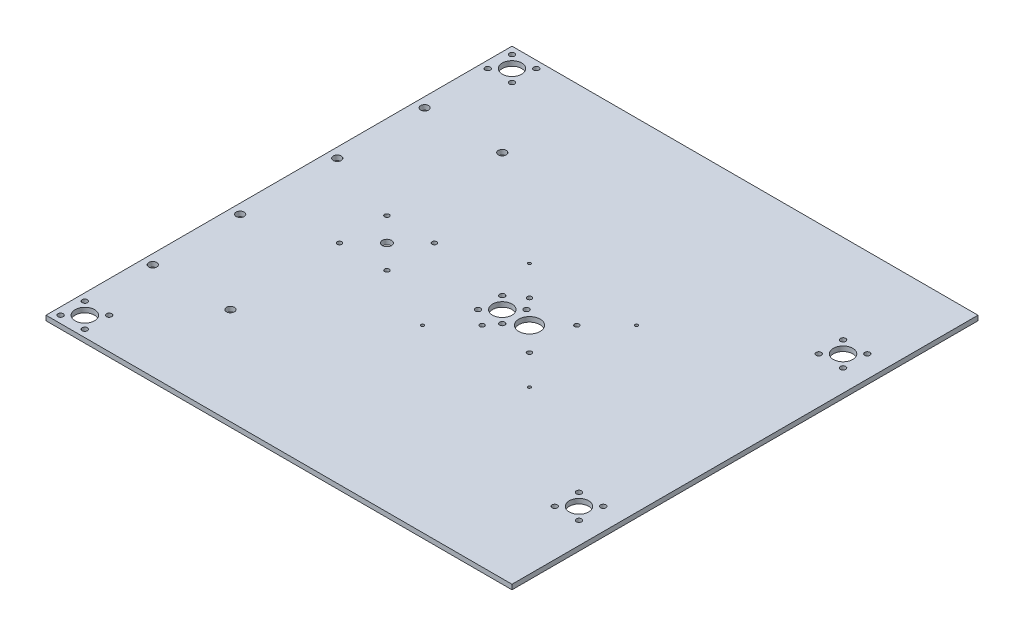
from build123d import *

# Parameters (mm, degrees)
SKETCH1_W               = 304.8
SKETCH1_H               = 304.8
BOSS_EXTRUDE1_DEPTH     = 3.175
SKETCH3_R               = 2.600000007
CUT_EXTRUDE1_DEPTH      = 216.549531721
SKETCH5_R               = 1.5
SKETCH5_R_2             = 2.999999969
CUT_EXTRUDE2_DEPTH      = 216.549531721
SKETCH7_R               = 0.999998
CUT_EXTRUDE3_DEPTH      = 216.549531721
CUT_EXTRUDE5_DEPTH      = 216.549531721
CUT_EXTRUDE5_DEPTH_BACK = 216.549531721
SKETCH9_R               = 1.726999975
SKETCH9_R_2             = 6.35
CUT_EXTRUDE6_DEPTH      = 216.549531721
CUT_EXTRUDE6_DEPTH_BACK = 216.549531721
SKETCH11_R              = 1.5
SKETCH11_R_2            = 6.985


with BuildPart() as part:
    # Sketch1 → Boss-Extrude1 (new body)
    with BuildSketch(Plane(origin=(0, 0, 0), x_dir=(1, 0, 0), z_dir=(0, 1, 0))):
        Rectangle(SKETCH1_W, SKETCH1_H)
    extrude(amount=BOSS_EXTRUDE1_DEPTH)

    # Sketch3 → Cut-Extrude1 (cut, through all)
    with BuildSketch(Plane(origin=(0, 3.175, 0), x_dir=(1, 0, 0), z_dir=(0, 1, 0))):
        with Locations((-146.05, -31.75)):
            Circle(SKETCH3_R)
        with Locations((-95.25, -88.9)):
            Circle(SKETCH3_R)
        with Locations((-146.05, -88.9)):
            Circle(SKETCH3_R)
    cut_extrude1 = extrude(amount=-CUT_EXTRUDE1_DEPTH, mode=Mode.SUBTRACT)

    # Mirror1: Cut-Extrude1 across plane
    add(cut_extrude1.mirror(Plane.XY), mode=Mode.SUBTRACT)

    # Sketch5 → Cut-Extrude2 (cut, through all)
    with BuildSketch(Plane(origin=(0, 3.175, 0), x_dir=(1, 0, 0), z_dir=(0, 1, 0))):
        with Locations((-66.312, 15.5)):
            Circle(SKETCH5_R)
        with Locations((-66.312, -15.5)):
            Circle(SKETCH5_R)
        with Locations((-97.312, 15.5)):
            Circle(SKETCH5_R)
        with Locations((-97.312, -15.5)):
            Circle(SKETCH5_R)
        with Locations((-81.812, 0)):
            Circle(SKETCH5_R_2)
    extrude(amount=-CUT_EXTRUDE2_DEPTH, mode=Mode.SUBTRACT)

    # Sketch7 → Cut-Extrude3 (cut, through all)
    with BuildSketch(Plane(origin=(0, 3.175, 0), x_dir=(1, 0, 0), z_dir=(0, 1, 0))):
        with Locations((46.431794783, -35.001777937)):
            Circle(SKETCH7_R)
        with Locations((-23.571780232, -35.001777937)):
            Circle(SKETCH7_R)
        with Locations((-23.571780232, 35.001797077)):
            Circle(SKETCH7_R)
        with Locations((46.431794783, 35.001797077)):
            Circle(SKETCH7_R)
    extrude(amount=-CUT_EXTRUDE3_DEPTH, mode=Mode.SUBTRACT)

    # Sketch9 → Cut-Extrude5 (cut, two sides: drawn at the far end of the back side and taken through both)
    with BuildSketch(Plane(origin=(0, 3.175, 0), x_dir=(1, 0, 0), z_dir=(0, 1, 0)).offset(-CUT_EXTRUDE5_DEPTH_BACK)):
        with Locations((-131.7625, -147.6375)):
            Circle(SKETCH9_R)
        with Locations((-131.7625, -131.7625)):
            Circle(SKETCH9_R)
        with Locations((-147.6375, -131.7625)):
            Circle(SKETCH9_R)
        with Locations((-147.6375, -147.6375)):
            Circle(SKETCH9_R)
        with Locations((-139.7, -139.7)):
            Circle(SKETCH9_R_2)
        with Locations((138.1125, -94.2975)):
            Circle(SKETCH9_R)
        with Locations((138.1125, -78.4225)):
            Circle(SKETCH9_R)
        with Locations((130.175, -86.36)):
            Circle(SKETCH9_R_2)
        with Locations((122.2375, -78.4225)):
            Circle(SKETCH9_R)
        with Locations((122.2375, -94.2975)):
            Circle(SKETCH9_R)
        with Locations((1.5875, 7.9375)):
            Circle(SKETCH9_R)
        with Locations((1.5875, -7.9375)):
            Circle(SKETCH9_R)
        with Locations((-6.35, 0)):
            Circle(SKETCH9_R_2)
        with Locations((-14.2875, -7.9375)):
            Circle(SKETCH9_R)
        with Locations((-14.2875, 7.9375)):
            Circle(SKETCH9_R)
        with Locations((122.2375, 94.2975)):
            Circle(SKETCH9_R)
        with Locations((122.2375, 78.4225)):
            Circle(SKETCH9_R)
        with Locations((138.1125, 94.2975)):
            Circle(SKETCH9_R)
        with Locations((130.175, 86.36)):
            Circle(SKETCH9_R_2)
        with Locations((138.1125, 78.4225)):
            Circle(SKETCH9_R)
        with Locations((-131.7625, 131.7625)):
            Circle(SKETCH9_R)
        with Locations((-131.7625, 147.6375)):
            Circle(SKETCH9_R)
        with Locations((-147.6375, 147.6375)):
            Circle(SKETCH9_R)
        with Locations((-147.6375, 131.7625)):
            Circle(SKETCH9_R)
        with Locations((-139.7, 139.7)):
            Circle(SKETCH9_R_2)
    extrude(amount=CUT_EXTRUDE5_DEPTH + CUT_EXTRUDE5_DEPTH_BACK, mode=Mode.SUBTRACT)

    # Sketch11 → Cut-Extrude6 (cut, two sides: drawn at the far end of the back side and taken through both)
    with BuildSketch(Plane(origin=(0, 3.175, 0), x_dir=(1, 0, 0), z_dir=(0, 1, 0)).offset(-CUT_EXTRUDE6_DEPTH_BACK)):
        with Locations((26.93, 15.5)):
            Circle(SKETCH11_R)
        with Locations((26.93, -15.5)):
            Circle(SKETCH11_R)
        with Locations((-4.07, -15.5)):
            Circle(SKETCH11_R)
        with Locations((-4.07, 15.5)):
            Circle(SKETCH11_R)
        with Locations((11.43, 0)):
            Circle(SKETCH11_R_2)
    extrude(amount=CUT_EXTRUDE6_DEPTH + CUT_EXTRUDE6_DEPTH_BACK, mode=Mode.SUBTRACT)


solid = part.part
